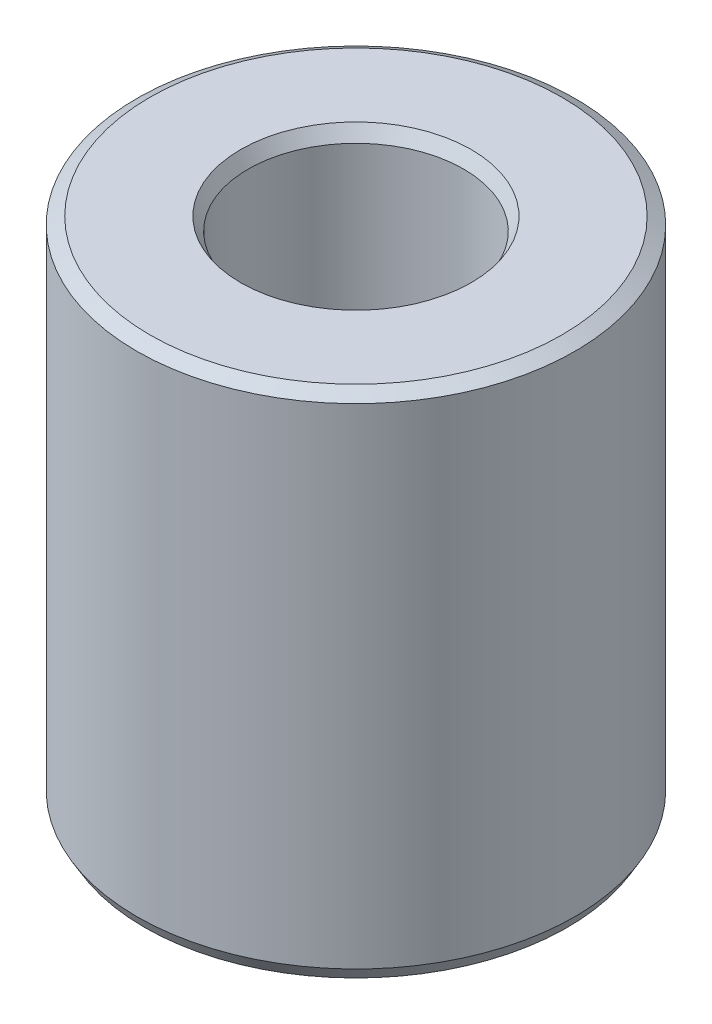
from build123d import *
from OCP.BRepFilletAPI import BRepFilletAPI_MakeChamfer

# Parameters (mm, degrees)
SKETCH1_R           = 55
BOSS_EXTRUDE1_DEPTH = 128.133976744
SKETCH2_R           = 27.057170354
CUT_EXTRUDE1_DEPTH  = 150.894349448
CHAMFER1_SIZE       = 1.902037366
CHAMFER1_SIZE2      = 3.294425357


with BuildPart() as part:
    # Sketch1 → Boss-Extrude1 (new body)
    with BuildSketch(Plane(origin=(0, 0, 0), x_dir=(1, 0, 0), z_dir=(0, 1, 0))):
        Circle(SKETCH1_R)
    extrude(amount=BOSS_EXTRUDE1_DEPTH)

    # Sketch2 → Cut-Extrude1 (cut, through all)
    with BuildSketch(Plane(origin=(0, 0, 0), x_dir=(1, 0, 0), z_dir=(0, 1, 0))):
        Circle(SKETCH2_R)
    extrude(amount=CUT_EXTRUDE1_DEPTH, mode=Mode.SUBTRACT)

    # Chamfer1: one chamfer whose edges measure the first distance from different faces: ONE call of the kernel's chamfer builder (chamfer() names one face for all edges)
    chamfer1_edges_1 = [part.edges().sort_by_distance(p)[0] for p in [
        (-27.057170354, 128.133976744, 0),
    ]]
    chamfer1_side_1 = [part.faces().sort_by_distance(p)[0] for p in [
        (-53.444365081, 128.133976744, 0),
    ]]
    chamfer1_edges_2 = [part.edges().sort_by_distance(p)[0] for p in [
        (-27.057170354, 0, 0),
    ]]
    chamfer1_side_2 = [part.faces().sort_by_distance(p)[0] for p in [
        (-27.057170354, 64.066988372, 0),
    ]]
    chamfer1_edges_3 = [part.edges().sort_by_distance(p)[0] for p in [
        (-55, 0, 0),
    ]]
    chamfer1_side_3 = [part.faces().sort_by_distance(p)[0] for p in [
        (-53.444365081, 0, 0),
    ]]
    chamfer1_edges_4 = [part.edges().sort_by_distance(p)[0] for p in [
        (-55, 128.133976744, 0),
    ]]
    chamfer1_side_4 = [part.faces().sort_by_distance(p)[0] for p in [
        (-55, 64.066988372, 0),
    ]]
    chamfer1 = BRepFilletAPI_MakeChamfer(part.part.solid().wrapped)
    for e in chamfer1_edges_1:
        chamfer1.Add(CHAMFER1_SIZE, CHAMFER1_SIZE2, e.wrapped, chamfer1_side_1[0].wrapped)  # the first distance lies on this face
    for e in chamfer1_edges_2:
        chamfer1.Add(CHAMFER1_SIZE, CHAMFER1_SIZE2, e.wrapped, chamfer1_side_2[0].wrapped)  # the first distance lies on this face
    for e in chamfer1_edges_3:
        chamfer1.Add(CHAMFER1_SIZE, CHAMFER1_SIZE2, e.wrapped, chamfer1_side_3[0].wrapped)  # the first distance lies on this face
    for e in chamfer1_edges_4:
        chamfer1.Add(CHAMFER1_SIZE, CHAMFER1_SIZE2, e.wrapped, chamfer1_side_4[0].wrapped)  # the first distance lies on this face
    add(Compound.cast(chamfer1.Shape()), mode=Mode.REPLACE)


solid = part.part
